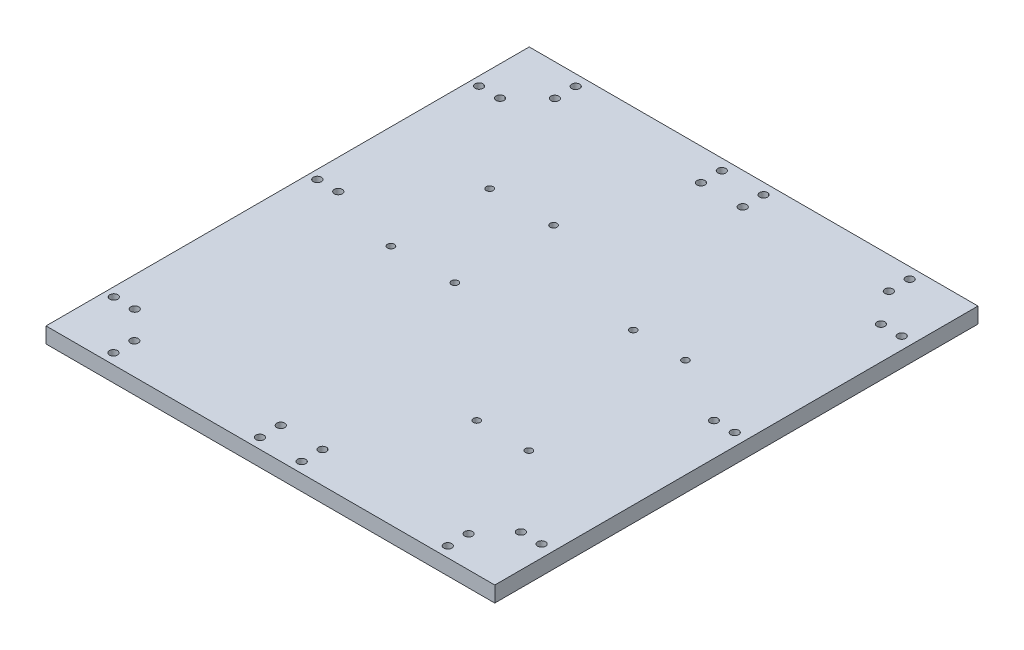
from build123d import *

# Parameters (mm, degrees)
SKETCH1_W           = 430
SKETCH1_H           = 463
BOSS_EXTRUDE1_DEPTH = 15
SKETCH12_R          = 3.8
CUT_EXTRUDE3_DEPTH  = 50.8
SKETCH6_R           = 3.3
CUT_EXTRUDE4_DEPTH  = 50.8
SKETCH7_R           = 3.3
CUT_EXTRUDE5_DEPTH  = 50.8


with BuildPart() as part:
    # Sketch1 → Boss-Extrude1 (new body)
    with BuildSketch(Plane(origin=(0, 0, 0), x_dir=(1, 0, 0), z_dir=(0, 1, 0))):
        Rectangle(SKETCH1_W, SKETCH1_H)
    extrude(amount=BOSS_EXTRUDE1_DEPTH)

    # Sketch12 → Cut-Extrude3 (cut)
    with BuildSketch(Plane(origin=(0, 0, 0), x_dir=(-1, 0, 0), z_dir=(0, -1, 0))):
        with Locations((-183.528683765, -175)):
            Circle(SKETCH12_R)
        with Locations((-203.398904111, 170)):
            Circle(SKETCH12_R)
        with Locations((-183.528683765, 10)):
            Circle(SKETCH12_R)
        with Locations((-203.398904111, 10)):
            Circle(SKETCH12_R)
        with Locations((-203.398904111, -175)):
            Circle(SKETCH12_R)
        with Locations((-183.528683765, 170)):
            Circle(SKETCH12_R)
        with Locations((206.525269648, -175)):
            Circle(SKETCH12_R)
        with Locations((206.525269648, 20)):
            Circle(SKETCH12_R)
        with Locations((186.44692003, 175)):
            Circle(SKETCH12_R)
        with Locations((206.52526965, 175)):
            Circle(SKETCH12_R)
        with Locations((186.44692003, -175)):
            Circle(SKETCH12_R)
        with Locations((186.446920025, 20)):
            Circle(SKETCH12_R)
        with Locations((160.349922153, -221.520559324)):
            Circle(SKETCH12_R)
        with Locations((160.349922153, -201.54839577)):
            Circle(SKETCH12_R)
        with Locations((20, -221.520559324)):
            Circle(SKETCH12_R)
        with Locations((20, -201.548395767)):
            Circle(SKETCH12_R)
        with Locations((-20, -201.54839577)):
            Circle(SKETCH12_R)
        with Locations((-20, -221.52055932)):
            Circle(SKETCH12_R)
        with Locations((-160, -221.52055932)):
            Circle(SKETCH12_R)
        with Locations((-160, -201.54839577)):
            Circle(SKETCH12_R)
        with Locations((160, 201.06768193)):
            Circle(SKETCH12_R)
        with Locations((160, 221.0363788)):
            Circle(SKETCH12_R)
        with Locations((20, 201.06768193)):
            Circle(SKETCH12_R)
        with Locations((20, 221.0363788)):
            Circle(SKETCH12_R)
        with Locations((-20, 201.06768193)):
            Circle(SKETCH12_R)
        with Locations((-20, 221.0363788)):
            Circle(SKETCH12_R)
        with Locations((-160, 201.067681927)):
            Circle(SKETCH12_R)
        with Locations((-160, 221.036378797)):
            Circle(SKETCH12_R)
    extrude(amount=-CUT_EXTRUDE3_DEPTH, mode=Mode.SUBTRACT)

    # Sketch6 → Cut-Extrude4 (cut)
    with BuildSketch(Plane(origin=(0, 15, 0), x_dir=(1, 0, 0), z_dir=(0, 1, 0))):
        with Locations((119.793345796, 46.373061352)):
            Circle(SKETCH6_R)
        with Locations((69.793345796, 46.373061352)):
            Circle(SKETCH6_R)
        with Locations((119.793345796, -103.626938648)):
            Circle(SKETCH6_R)
        with Locations((69.793345796, -103.626938648)):
            Circle(SKETCH6_R)
    extrude(amount=-CUT_EXTRUDE4_DEPTH, mode=Mode.SUBTRACT)

    # Sketch7 → Cut-Extrude5 (cut)
    with BuildSketch(Plane(origin=(0, 15, 0), x_dir=(1, 0, 0), z_dir=(0, 1, 0))):
        with Locations((-116.362714529, 94.945868521)):
            Circle(SKETCH7_R)
        with Locations((-55.363204635, 95.191638193)):
            Circle(SKETCH7_R)
        with Locations((-54.980448566, 0.192396061)):
            Circle(SKETCH7_R)
        with Locations((-115.97995846, -0.053373612)):
            Circle(SKETCH7_R)
    extrude(amount=-CUT_EXTRUDE5_DEPTH, mode=Mode.SUBTRACT)


solid = part.part
